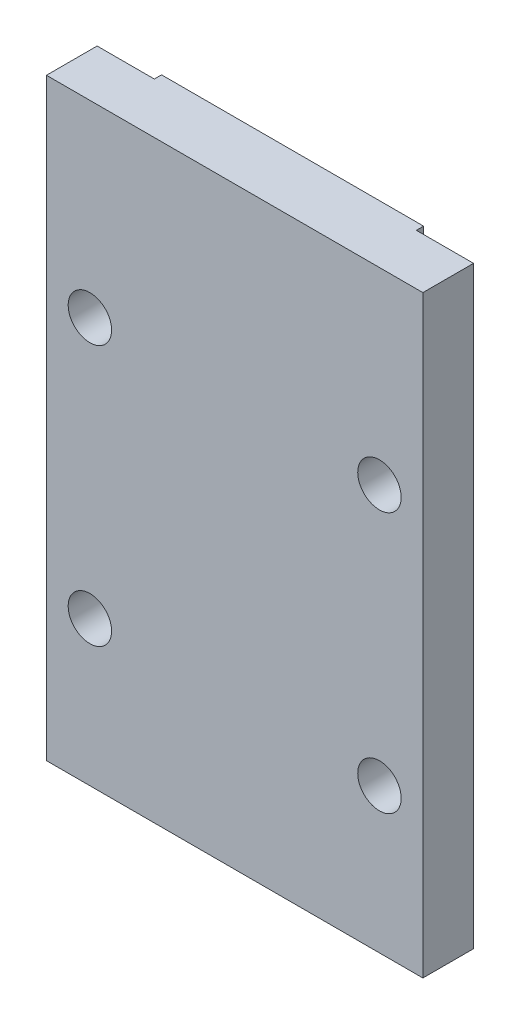
from build123d import *

# Parameters (mm, degrees)
SKETCH1_W           = 26
SKETCH1_H           = 41
SKETCH1_R           = 1.5
BOSS_EXTRUDE1_DEPTH = 4
SKETCH3_OUTSIDE_W   = 37.742
SKETCH3_OUTSIDE_H   = 52.742
CUT_EXTRUDE1_DEPTH  = 0.5


with BuildPart() as part:
    # Sketch1 → Boss-Extrude1 (new body)
    with BuildSketch(Plane.XY):
        with Locations((13, 20.5)):
            Rectangle(SKETCH1_W, SKETCH1_H)
        with Locations((3, 28)):
            Circle(SKETCH1_R, mode=Mode.SUBTRACT)
        with Locations((3, 10)):
            Circle(SKETCH1_R, mode=Mode.SUBTRACT)
        with Locations((23, 10)):
            Circle(SKETCH1_R, mode=Mode.SUBTRACT)
        with Locations((23, 28)):
            Circle(SKETCH1_R, mode=Mode.SUBTRACT)
    extrude(amount=BOSS_EXTRUDE1_DEPTH)

    # Sketch3 outside → Cut-Extrude1 (cut)
    with BuildSketch(Plane(origin=(0, 0, 0), x_dir=(-1, 0, 0), z_dir=(0, 0, -1))):
        with Locations((-13, 20.5)):
            Rectangle(SKETCH3_OUTSIDE_W, SKETCH3_OUTSIDE_H)
        with BuildLine():
            Line((-3.95, 41), (-22.05, 41))
            Line((-22.05, 41), (-22.05, 31))
            Line((-22.05, 31), (-15.7, 31))
            ThreePointArc((-15.7, 31), (-14.2, 29.5), (-15.7, 28))
            Line((-15.7, 28), (-15.7, 12))
            ThreePointArc((-15.7, 12), (-14.2, 10.5), (-15.7, 9))
            Line((-15.7, 9), (-17.45, 9))
            Line((-17.45, 9), (-17.45, 4))
            Line((-17.45, 4), (-8.55, 4))
            Line((-8.55, 4), (-8.55, 9))
            Line((-8.55, 9), (-10.3, 9))
            ThreePointArc((-10.3, 9), (-11.8, 10.5), (-10.3, 12))
            Line((-10.3, 12), (-10.3, 28))
            ThreePointArc((-10.3, 28), (-11.8, 29.5), (-10.3, 31))
            Line((-10.3, 31), (-3.95, 31))
            Line((-3.95, 31), (-3.95, 41))
        make_face(mode=Mode.SUBTRACT)
    extrude(amount=-CUT_EXTRUDE1_DEPTH, mode=Mode.SUBTRACT)


solid = part.part
